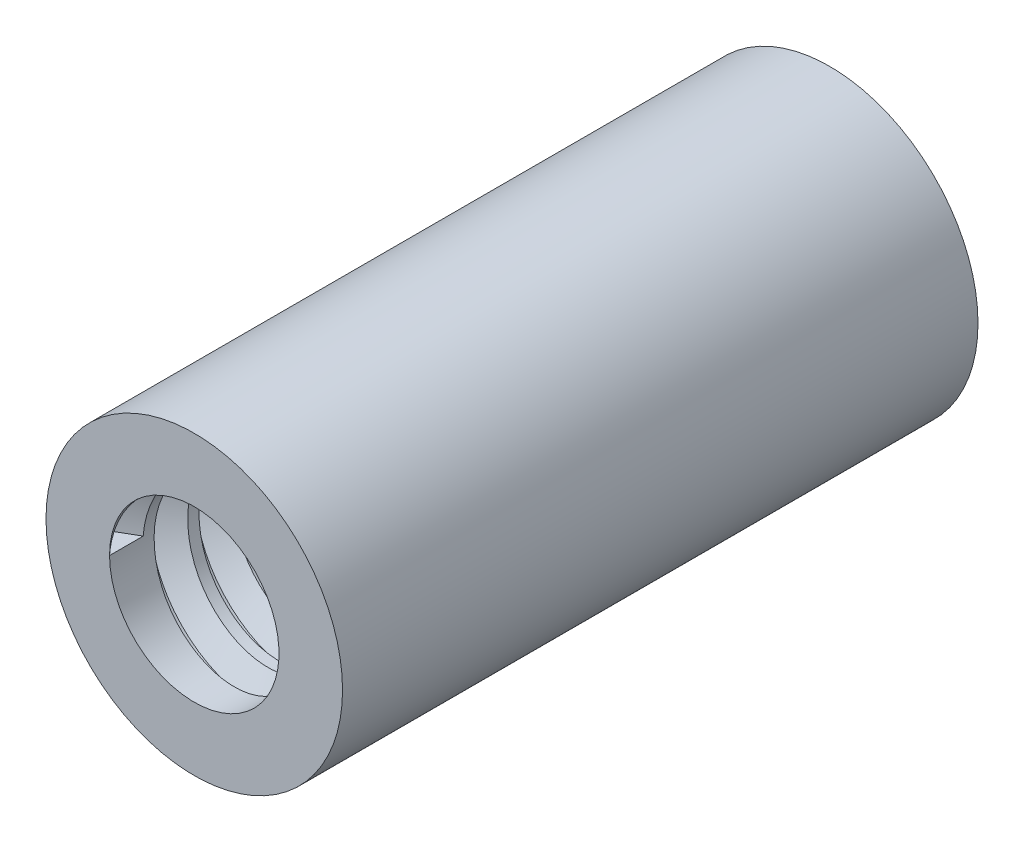
from build123d import *
from build123d.topology import SkipClean

# Parameters (mm, degrees)
SKETCH1_R           = 3.5
BOSS_EXTRUDE1_DEPTH = 15
SKETCH2_R           = 2
CUT_EXTRUDE1_DEPTH  = 7
THREAD1_PITCH       = 1.058333333


with BuildPart() as part:
    # Sketch1 → Boss-Extrude1 (new body)
    with BuildSketch(Plane.XY):
        Circle(SKETCH1_R)
    extrude(amount=BOSS_EXTRUDE1_DEPTH)

    # Sketch2 → Cut-Extrude1 (cut)
    with BuildSketch(Plane.XY.offset(15)):
        Circle(SKETCH2_R)
    extrude(amount=-CUT_EXTRUDE1_DEPTH, mode=Mode.SUBTRACT)

    # Thread1: the profile of Thread Profile1 profile screwed along a right-hand helix of 11.338583 turns, 8 arcs to a turn; built about Z, then put on its axis
    with SkipClean():  # the faces are left unmerged after this step: merging them gives an invalid solid
        thread1_z = Axis((0, 0, 0), (0, 0, 1))
        thread1_corners = [(1.9997, 0, -0.000173205), (2.572839718, 0, 0.330729165), (2.572839718, 0, 0.463020832), (1.9997, 0, 0.793923202)]
        with BuildLine(mode=Mode.PRIVATE) as thread1_profile:
            Line(thread1_corners[0], thread1_corners[1])
            Line(thread1_corners[1], thread1_corners[2])
            Line(thread1_corners[2], thread1_corners[3])
            Line(thread1_corners[3], thread1_corners[0])
        thread1_cap = Face(thread1_profile.wire())
        thread1_turn_angles = [0, 22.5, 45, 67.5, 90, 112.5, 135, 157.5, 180, 202.5, 225, 247.5, 270, 292.5, 315, 337.5, 360]
        thread1_turn_weights = [1, 0.9238795325112867, 1, 0.9238795325112867, 1, 0.9238795325112867, 1, 0.9238795325112867, 1, 0.9238795325112867, 1, 0.9238795325112867, 1, 0.9238795325112867, 1, 0.9238795325112867, 1]
        thread1_turn_rails = [Edge.make_bspline([Vector(p[0], p[1], 0).rotate(thread1_z, thread1_turn_angles[k]) / thread1_turn_weights[k] + Vector(0, 0, p[2] + THREAD1_PITCH * thread1_turn_angles[k] / 360) for k in range(17)], [0, 0, 0, 1, 1, 2, 2, 3, 3, 4, 4, 5, 5, 6, 6, 7, 7, 8, 8, 8], 2, thread1_turn_weights) for p in thread1_corners]
        thread1_turn_sides = [Face.make_surface_from_curves(thread1_turn_rails[p[0]], thread1_turn_rails[p[1]]) for p in [(0, 1), (1, 2), (2, 3), (3, 0)]]
        thread1_last_angles = [3960, 3982.5, 4005, 4027.5, 4050, 4065.94488189, 4081.88976378]
        thread1_last_weights = [1, 0.9238795325112867, 1, 0.9238795325112867, 1, 0.9615264121767717, 1]
        thread1_last_rails = [Edge.make_bspline([Vector(p[0], p[1], 0).rotate(thread1_z, thread1_last_angles[k]) / thread1_last_weights[k] + Vector(0, 0, p[2] + THREAD1_PITCH * thread1_last_angles[k] / 360) for k in range(7)], [0, 0, 0, 1, 1, 2, 2, 3, 3, 3], 2, thread1_last_weights) for p in thread1_corners]
        thread1_last_sides = [Face.make_surface_from_curves(thread1_last_rails[p[0]], thread1_last_rails[p[1]]) for p in [(0, 1), (1, 2), (2, 3), (3, 0)]]
        thread1 = Plane(origin=(0, 0, 15), x_dir=(-1, 0, 0), z_dir=(0, 0, -1)) * Solid(Shell([*[p.moved(Location((0, 0, THREAD1_PITCH * i))) for i in range(11) for p in thread1_turn_sides], *thread1_last_sides, thread1_cap, thread1_cap.rotate(thread1_z, 4081.88976378).moved(Location((0, 0, THREAD1_PITCH * 4081.88976378 / 360)))]))
        add(thread1, mode=Mode.SUBTRACT)


solid = part.part
